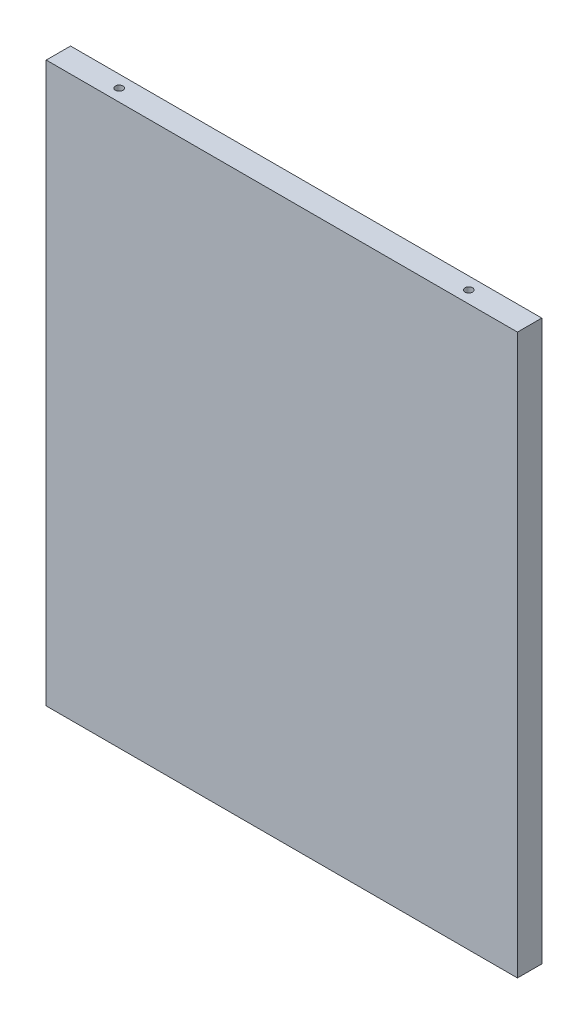
from build123d import *

# Parameters (mm, degrees)
SKETCH_1_W            = 310
SKETCH_1_H            = 368
EXTRUDE_5906_DEPTH    = 16
SKETCH_11_R           = 2.5
CUT_EXTRUDE_1_DEPTH   = 37
SKETCH_12_R           = 2.5
CUT_EXTRUDE_2_DEPTH   = 37
CUT_EXTRUDE_START     = -37
SKETCH_19_R           = 2.5
CUT_EXTRUDE_1_2_DEPTH = 37
SKETCH_20_R           = 2.5
CUT_EXTRUDE_2_2_DEPTH = 37


with BuildPart() as part:
    # Эскиз1 → Extrude 5906 (new body)
    with BuildSketch(Plane.XY):
        with Locations((155, 184)):
            Rectangle(SKETCH_1_W, SKETCH_1_H)
    extrude(amount=EXTRUDE_5906_DEPTH)

    # Эскиз11 → Cut-Extrude 1 (cut)
    with BuildSketch(Plane(origin=(0, 368, 0), x_dir=(1, 0, 0), z_dir=(0, 1, 0))):
        with Locations((40, -8)):
            Circle(SKETCH_11_R)
    extrude(amount=-CUT_EXTRUDE_1_DEPTH, mode=Mode.SUBTRACT)

    # Эскиз12 → Cut-Extrude 2 (cut)
    with BuildSketch(Plane(origin=(0, 368, 0), x_dir=(1, 0, 0), z_dir=(0, 1, 0))):
        with Locations((270, -8)):
            Circle(SKETCH_12_R)
    extrude(amount=-CUT_EXTRUDE_2_DEPTH, mode=Mode.SUBTRACT)

    # Эскиз19 → Cut-Extrude 1 2 (cut)
    with BuildSketch(Plane.XZ.offset(CUT_EXTRUDE_START)):
        with Locations((270, 8)):
            Circle(SKETCH_19_R)
    extrude(amount=CUT_EXTRUDE_1_2_DEPTH, mode=Mode.SUBTRACT)

    # Эскиз20 → Cut-Extrude 2 2 (cut)
    with BuildSketch(Plane.XZ.offset(CUT_EXTRUDE_START)):
        with Locations((40, 8)):
            Circle(SKETCH_20_R)
    extrude(amount=CUT_EXTRUDE_2_2_DEPTH, mode=Mode.SUBTRACT)


solid = part.part
